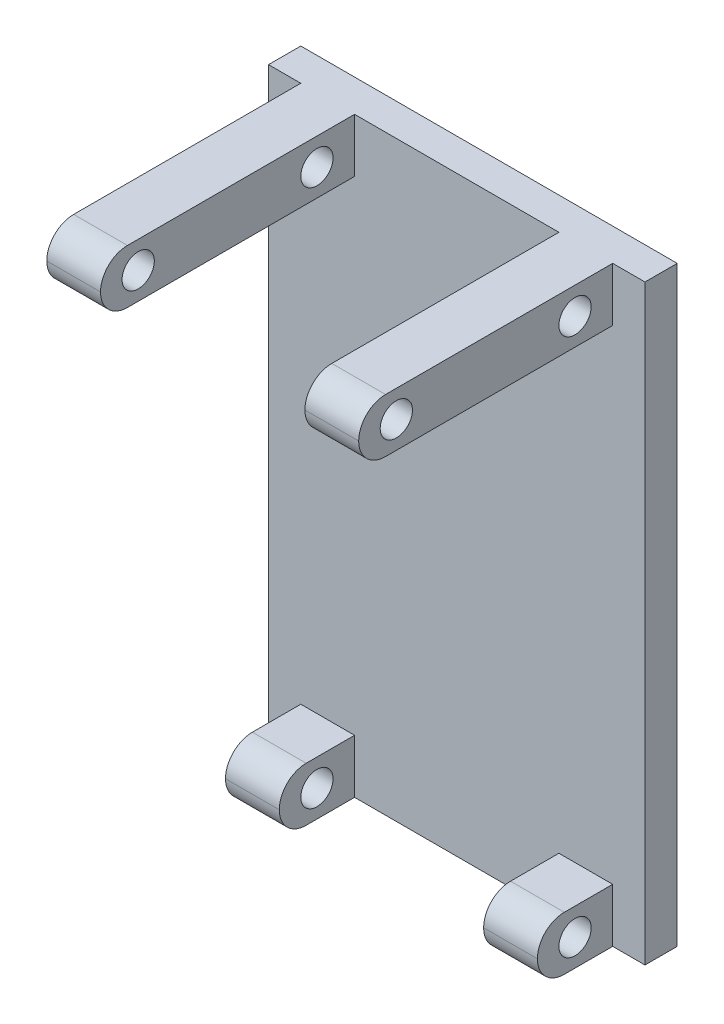
from build123d import *

# Parameters (mm, degrees)
SKETCH1_W           = 35
SKETCH1_H           = 55
BOSS_EXTRUDE1_DEPTH = 3
SKETCH2_W           = 5
SKETCH2_H           = 5
BOSS_EXTRUDE2_DEPTH = 7
CUT_EXTRUDE1_REACH  = 45.362
FILLET1_R           = 2.5
SKETCH4_W           = 5
SKETCH4_H           = 5
BOSS_EXTRUDE3_DEPTH = 16.61764706
CUT_EXTRUDE2_REACH  = 51.887
FILLET2_R           = 2.5


with BuildPart() as part:
    # Sketch1 → Boss-Extrude1 (new body)
    with BuildSketch(Plane.XY):
        Rectangle(SKETCH1_W, SKETCH1_H)
    extrude(amount=BOSS_EXTRUDE1_DEPTH)

    # Sketch2 → Boss-Extrude2 (add)
    with BuildSketch(Plane.XY.offset(3)):
        with Locations((-12, 25)):
            Rectangle(SKETCH2_W, SKETCH2_H)
        with Locations((12, 25)):
            Rectangle(SKETCH2_W, SKETCH2_H)
        with Locations((-12, -25)):
            Rectangle(SKETCH2_W, SKETCH2_H)
        with Locations((12, -25)):
            Rectangle(SKETCH2_W, SKETCH2_H)
    extrude(amount=BOSS_EXTRUDE2_DEPTH)

    # Cut-Extrude1: up to this face of the body (flat: up to its plane)
    cut_extrude1_end = Plane(part.part.faces().sort_by_distance((14.5, 25, 6.5))[0])
    # Sketch3 → Cut-Extrude1 (cut, up to the picked face)
    with BuildSketch(Plane.ZY.offset(14.5), mode=Mode.PRIVATE) as cut_extrude1_sk1:
        with BuildLine():
            ThreePointArc((8, 25), (6.957766147, 26.428443263), (5.279399793, 25.871857291))
            Line((5.279399793, 25.871857291), (7.720600207, 24.128142709))
            ThreePointArc((7.720600207, 24.128142709), (7.928443263, 24.542233853), (8, 25))
        make_face()
    cut_extrude1_tool1 = split(extrude(cut_extrude1_sk1.sketch, amount=-CUT_EXTRUDE1_REACH, mode=Mode.PRIVATE), bisect_by=cut_extrude1_end, keep=Keep.BOTH, mode=Mode.PRIVATE)
    # Sketch3 → Cut-Extrude1 (cut, up to the picked face)
    with BuildSketch(Plane.ZY.offset(14.5), mode=Mode.PRIVATE) as cut_extrude1_sk2:
        with BuildLine():
            Line((7.720600207, 24.128142709), (5.279399793, 25.871857291))
            ThreePointArc((5.279399793, 25.871857291), (5.628142709, 23.779399793), (7.720600207, 24.128142709))
        make_face()
    cut_extrude1_tool2 = split(extrude(cut_extrude1_sk2.sketch, amount=-CUT_EXTRUDE1_REACH, mode=Mode.PRIVATE), bisect_by=cut_extrude1_end, keep=Keep.BOTH, mode=Mode.PRIVATE)
    # Sketch3 → Cut-Extrude1 (cut, up to the picked face)
    with BuildSketch(Plane.ZY.offset(14.5), mode=Mode.PRIVATE) as cut_extrude1_sk3:
        with BuildLine():
            ThreePointArc((8, 25), (6.957766147, 26.428443263), (5.279399793, 25.871857291))
            Line((5.279399793, 25.871857291), (7.720600207, 24.128142709))
            ThreePointArc((7.720600207, 24.128142709), (7.928443263, 24.542233853), (8, 25))
        make_face()
    cut_extrude1_tool3 = split(extrude(cut_extrude1_sk3.sketch, amount=-CUT_EXTRUDE1_REACH, mode=Mode.PRIVATE), bisect_by=cut_extrude1_end, keep=Keep.BOTH, mode=Mode.PRIVATE)
    # Sketch3 → Cut-Extrude1 (cut, up to the picked face)
    with BuildSketch(Plane.ZY.offset(14.5), mode=Mode.PRIVATE) as cut_extrude1_sk4:
        with BuildLine():
            Line((7.720600207, 24.128142709), (5.279399793, 25.871857291))
            ThreePointArc((5.279399793, 25.871857291), (5.628142709, 23.779399793), (7.720600207, 24.128142709))
        make_face()
    cut_extrude1_tool4 = split(extrude(cut_extrude1_sk4.sketch, amount=-CUT_EXTRUDE1_REACH, mode=Mode.PRIVATE), bisect_by=cut_extrude1_end, keep=Keep.BOTH, mode=Mode.PRIVATE)
    # Sketch3 → Cut-Extrude1 (cut, up to the picked face)
    with BuildSketch(Plane.ZY.offset(14.5), mode=Mode.PRIVATE) as cut_extrude1_sk5:
        with BuildLine():
            ThreePointArc((8, -25), (6.957766147, -23.571556737), (5.279399793, -24.128142709))
            Line((5.279399793, -24.128142709), (7.720600207, -25.871857291))
            ThreePointArc((7.720600207, -25.871857291), (7.928443263, -25.457766147), (8, -25))
        make_face()
    cut_extrude1_tool5 = split(extrude(cut_extrude1_sk5.sketch, amount=-CUT_EXTRUDE1_REACH, mode=Mode.PRIVATE), bisect_by=cut_extrude1_end, keep=Keep.BOTH, mode=Mode.PRIVATE)
    # Sketch3 → Cut-Extrude1 (cut, up to the picked face)
    with BuildSketch(Plane.ZY.offset(14.5), mode=Mode.PRIVATE) as cut_extrude1_sk6:
        with BuildLine():
            Line((7.720600207, -25.871857291), (5.279399793, -24.128142709))
            ThreePointArc((5.279399793, -24.128142709), (5.628142709, -26.220600207), (7.720600207, -25.871857291))
        make_face()
    cut_extrude1_tool6 = split(extrude(cut_extrude1_sk6.sketch, amount=-CUT_EXTRUDE1_REACH, mode=Mode.PRIVATE), bisect_by=cut_extrude1_end, keep=Keep.BOTH, mode=Mode.PRIVATE)
    # Sketch3 → Cut-Extrude1 (cut, up to the picked face)
    with BuildSketch(Plane.ZY.offset(14.5), mode=Mode.PRIVATE) as cut_extrude1_sk7:
        with BuildLine():
            ThreePointArc((8, -25), (6.957766147, -23.571556737), (5.279399793, -24.128142709))
            Line((5.279399793, -24.128142709), (7.720600207, -25.871857291))
            ThreePointArc((7.720600207, -25.871857291), (7.928443263, -25.457766147), (8, -25))
        make_face()
    cut_extrude1_tool7 = split(extrude(cut_extrude1_sk7.sketch, amount=-CUT_EXTRUDE1_REACH, mode=Mode.PRIVATE), bisect_by=cut_extrude1_end, keep=Keep.BOTH, mode=Mode.PRIVATE)
    # Sketch3 → Cut-Extrude1 (cut, up to the picked face)
    with BuildSketch(Plane.ZY.offset(14.5), mode=Mode.PRIVATE) as cut_extrude1_sk8:
        with BuildLine():
            Line((7.720600207, -25.871857291), (5.279399793, -24.128142709))
            ThreePointArc((5.279399793, -24.128142709), (5.628142709, -26.220600207), (7.720600207, -25.871857291))
        make_face()
    cut_extrude1_tool8 = split(extrude(cut_extrude1_sk8.sketch, amount=-CUT_EXTRUDE1_REACH, mode=Mode.PRIVATE), bisect_by=cut_extrude1_end, keep=Keep.BOTH, mode=Mode.PRIVATE)
    add(cut_extrude1_tool1.solids().sort_by(Axis((-14.5, 25.518039, 6.870028), (1, 0, 0)))[0], mode=Mode.SUBTRACT)
    add(cut_extrude1_tool2.solids().sort_by(Axis((-14.5, 24.481961, 6.129972), (1, 0, 0)))[0], mode=Mode.SUBTRACT)
    add(cut_extrude1_tool3.solids().sort_by(Axis((-14.5, 25.518039, 6.870028), (1, 0, 0)))[0], mode=Mode.SUBTRACT)
    add(cut_extrude1_tool4.solids().sort_by(Axis((-14.5, 24.481961, 6.129972), (1, 0, 0)))[0], mode=Mode.SUBTRACT)
    add(cut_extrude1_tool5.solids().sort_by(Axis((-14.5, -24.481961, 6.870028), (1, 0, 0)))[0], mode=Mode.SUBTRACT)
    add(cut_extrude1_tool6.solids().sort_by(Axis((-14.5, -25.518039, 6.129972), (1, 0, 0)))[0], mode=Mode.SUBTRACT)
    add(cut_extrude1_tool7.solids().sort_by(Axis((-14.5, -24.481961, 6.870028), (1, 0, 0)))[0], mode=Mode.SUBTRACT)
    add(cut_extrude1_tool8.solids().sort_by(Axis((-14.5, -25.518039, 6.129972), (1, 0, 0)))[0], mode=Mode.SUBTRACT)

    # Fillet1
    fillet1_edges = [part.edges().sort_by_distance(p)[0] for p in [
        (12, -27.5, 10),
        (12, -22.5, 10),
        (-12, -27.5, 10),
        (-12, -22.5, 10),
    ]]
    fillet(fillet1_edges, radius=FILLET1_R - 0.0001)  # a hair under: the kernel refuses the full size

    # Sketch4 → Boss-Extrude3 (add)
    with BuildSketch(Plane.XY.offset(10)):
        with Locations((-12, 25)):
            Rectangle(SKETCH4_W, SKETCH4_H)
        with Locations((12, 25)):
            Rectangle(SKETCH4_W, SKETCH4_H)
    extrude(amount=BOSS_EXTRUDE3_DEPTH)

    # Cut-Extrude2: up to this face of the body (flat: up to its plane)
    cut_extrude2_end = Plane(part.part.faces().sort_by_distance((14.5, 25, 15.337843498))[0])
    # Sketch5 → Cut-Extrude2 (cut, up to the picked face)
    with BuildSketch(Plane.ZY.offset(14.5), mode=Mode.PRIVATE) as cut_extrude2_sk1:
        with BuildLine():
            ThreePointArc((24.61764706, 25), (23.575413207, 26.428443263), (21.897046853, 25.871857291))
            Line((21.897046853, 25.871857291), (24.338247267, 24.128142709))
            ThreePointArc((24.338247267, 24.128142709), (24.546090323, 24.542233853), (24.61764706, 25))
        make_face()
    cut_extrude2_tool1 = split(extrude(cut_extrude2_sk1.sketch, amount=-CUT_EXTRUDE2_REACH, mode=Mode.PRIVATE), bisect_by=cut_extrude2_end, keep=Keep.BOTH, mode=Mode.PRIVATE)
    # Sketch5 → Cut-Extrude2 (cut, up to the picked face)
    with BuildSketch(Plane.ZY.offset(14.5), mode=Mode.PRIVATE) as cut_extrude2_sk2:
        with BuildLine():
            Line((24.338247267, 24.128142709), (21.897046853, 25.871857291))
            ThreePointArc((21.897046853, 25.871857291), (22.245789769, 23.779399793), (24.338247267, 24.128142709))
        make_face()
    cut_extrude2_tool2 = split(extrude(cut_extrude2_sk2.sketch, amount=-CUT_EXTRUDE2_REACH, mode=Mode.PRIVATE), bisect_by=cut_extrude2_end, keep=Keep.BOTH, mode=Mode.PRIVATE)
    # Sketch5 → Cut-Extrude2 (cut, up to the picked face)
    with BuildSketch(Plane.ZY.offset(14.5), mode=Mode.PRIVATE) as cut_extrude2_sk3:
        with BuildLine():
            ThreePointArc((24.61764706, 25), (23.575413207, 26.428443263), (21.897046853, 25.871857291))
            Line((21.897046853, 25.871857291), (24.338247267, 24.128142709))
            ThreePointArc((24.338247267, 24.128142709), (24.546090323, 24.542233853), (24.61764706, 25))
        make_face()
    cut_extrude2_tool3 = split(extrude(cut_extrude2_sk3.sketch, amount=-CUT_EXTRUDE2_REACH, mode=Mode.PRIVATE), bisect_by=cut_extrude2_end, keep=Keep.BOTH, mode=Mode.PRIVATE)
    # Sketch5 → Cut-Extrude2 (cut, up to the picked face)
    with BuildSketch(Plane.ZY.offset(14.5), mode=Mode.PRIVATE) as cut_extrude2_sk4:
        with BuildLine():
            Line((24.338247267, 24.128142709), (21.897046853, 25.871857291))
            ThreePointArc((21.897046853, 25.871857291), (22.245789769, 23.779399793), (24.338247267, 24.128142709))
        make_face()
    cut_extrude2_tool4 = split(extrude(cut_extrude2_sk4.sketch, amount=-CUT_EXTRUDE2_REACH, mode=Mode.PRIVATE), bisect_by=cut_extrude2_end, keep=Keep.BOTH, mode=Mode.PRIVATE)
    add(cut_extrude2_tool1.solids().sort_by(Axis((-14.5, 25.518039, 23.487675), (1, 0, 0)))[0], mode=Mode.SUBTRACT)
    add(cut_extrude2_tool2.solids().sort_by(Axis((-14.5, 24.481961, 22.747619), (1, 0, 0)))[0], mode=Mode.SUBTRACT)
    add(cut_extrude2_tool3.solids().sort_by(Axis((-14.5, 25.518039, 23.487675), (1, 0, 0)))[0], mode=Mode.SUBTRACT)
    add(cut_extrude2_tool4.solids().sort_by(Axis((-14.5, 24.481961, 22.747619), (1, 0, 0)))[0], mode=Mode.SUBTRACT)

    # Fillet2
    fillet2_edges = [part.edges().sort_by_distance(p)[0] for p in [
        (12, 22.5, 26.61764706),
        (12, 27.5, 26.61764706),
        (-12, 22.5, 26.61764706),
        (-12, 27.5, 26.61764706),
    ]]
    fillet(fillet2_edges, radius=FILLET2_R - 0.0001)  # a hair under: the kernel refuses the full size


solid = part.part
